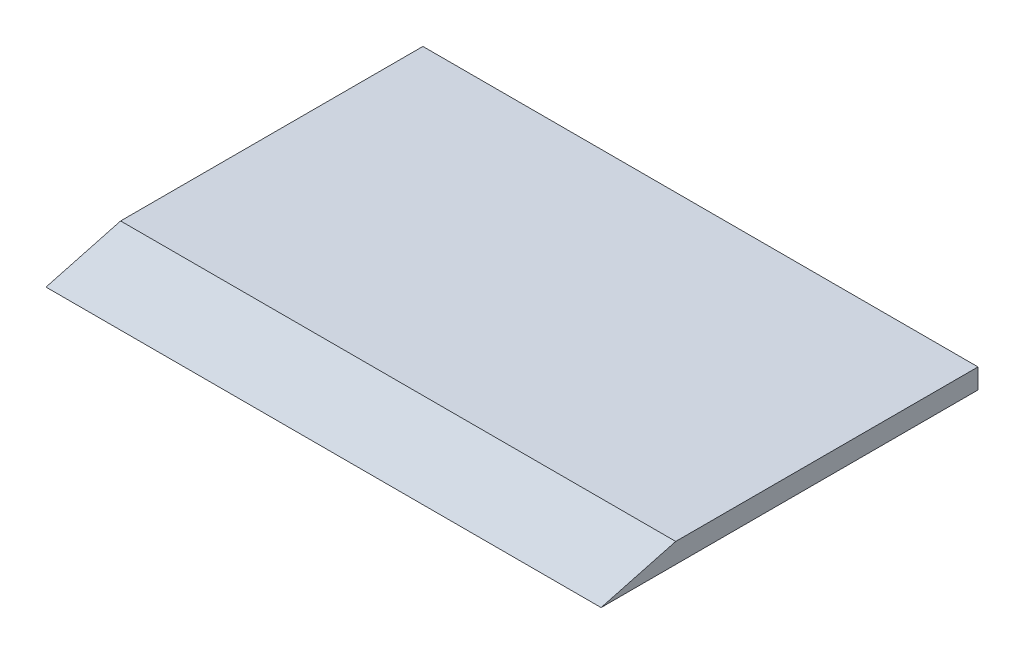
from build123d import *

# Parameters (mm, degrees)
SALIENTE_EXTRUIR1_DEPTH = 100


with BuildPart() as part:
    # Croquis1 → Saliente-Extruir1 (new body)
    with BuildSketch(Plane(origin=(0, 0, 0), x_dir=(0, 0, -1), z_dir=(1, 0, 0))):
        Polygon((0, 0), (67.9, 0), (67.9, 3.6), (13.44, 3.6), align=None)
    extrude(amount=SALIENTE_EXTRUIR1_DEPTH)


solid = part.part
